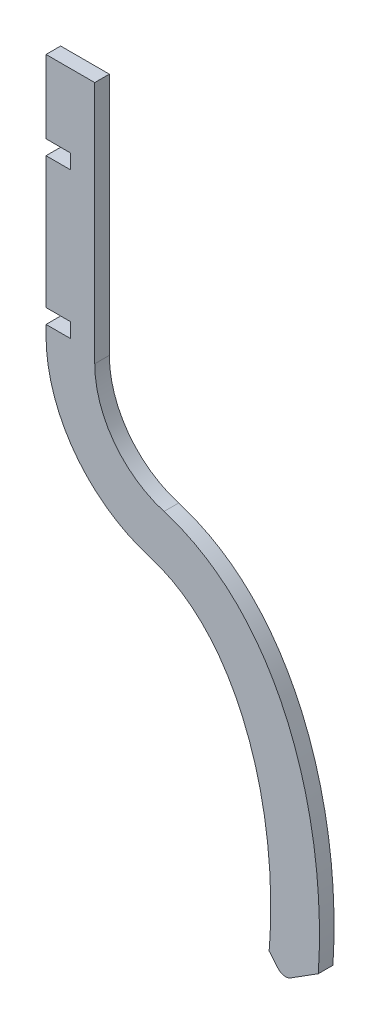
from build123d import *

# Parameters (mm, degrees)
BOSS_EXTRU_2_DEPTH      = 3
ENL_V_MAT_EXTRU_1_DEPTH = 141.768934672
EMPREINTE1_START        = 63.105178129
EMPREINTE1_DEPTH        = 3
EMPREINTE1_START_2      = 93.105178129
EMPREINTE1_2_DEPTH      = 3


# Read off the part's stored shape, not the designer's step: Empreinte1
with BuildPart() as part:
    # Esquisse1 → Boss.-Extru.2 (new body)
    with BuildSketch(Plane.XY):
        with BuildLine():
            Line((40.247233076, 111.105178129), (40.247233076, 61.105178129))
            ThreePointArc((40.247233076, 61.105178129), (44.191308202, 49.180108885), (54.467960723, 41.95837654))
            add(Edge.make_bspline(
                [(54.467960723, 41.95837654), (93.469157599, 30.186251687), (94.060386504, -42.130931626), (70.625681641, -69.023414216)],
                knots=[0.073601613, 0.073601613, 0.073601613, 0.073601613, 1, 1, 1, 1], degree=3))
            Line((70.625681641, -69.023414216), (63.086562616, -62.453658944))
            add(Edge.make_bspline(
                [(51.578324546, 32.384975746), (52.441823747, 32.124337068), (54.160244695, 31.504173294), (57.306848095, 29.97035453), (60.909260152, 27.464002891), (64.778911343, 23.487842732), (69.333722485, 16.888912111), (73.713189985, 6.383804922), (76.439302823, -8.617528818), (76.523407917, -21.892716717), (75.336804817, -32.248132674), (73.851279993, -39.698340102), (71.811754469, -46.646923176), (69.699842941, -51.863805262), (67.806756273, -55.601272185), (66.298875889, -58.166006571), (64.985680603, -60.08494816), (63.904092742, -61.488799964), (63.366023798, -62.13296342), (63.086562616, -62.453658944)],
                knots=[0.073601613, 0.073601613, 0.073601613, 0.073601613, 0.102551563, 0.131501512, 0.189401411, 0.247301311, 0.30520121, 0.421001008, 0.536800806, 0.652600605, 0.710500504, 0.768400403, 0.826300302, 0.884200202, 0.913150151, 0.942100101, 0.97105005, 0.985525025, 1, 1, 1, 1], degree=3))
            ThreePointArc((51.578324546, 32.384975746), (36.163345766, 43.217574263), (30.247233076, 61.105178129))
            Line((30.247233076, 61.105178129), (30.247233076, 111.105178129))
            Line((30.247233076, 111.105178129), (40.247233076, 111.105178129))
        make_face()
    extrude(amount=BOSS_EXTRU_2_DEPTH)

    # Esquisse2 → Enlèv. mat.-Extru.1 (cut, through all)
    with BuildSketch(Plane.XY.offset(3)):
        with BuildLine():
            Line((58.604840791, -65.718091867), (72.675095618, -21.396789164))
            Line((72.675095618, -21.396789164), (77.883188433, -27.569343611))
            ThreePointArc((77.883188433, -27.569343611), (79.106345528, -28.256142913), (80.479757382, -27.970579539))
            Line((80.479757382, -27.970579539), (87.91787168, -23.272823141))
            Line((87.91787168, -23.272823141), (76.157367596, -75.355055511))
            Line((76.157367596, -75.355055511), (58.604840791, -65.718091867))
        make_face()
    extrude(amount=-ENL_V_MAT_EXTRU_1_DEPTH, mode=Mode.SUBTRACT)

    # Empreinte1 outline → Empreinte1 (cut)
    with BuildSketch(Plane(origin=(0, 0, 0), x_dir=(1, 0, 0), z_dir=(0, 1, 0)).offset(EMPREINTE1_START)):
        with BuildLine():
            ThreePointArc((40.222725568, -0.2), (40.219098005, -0.099995306), (40.215220265, 0))
            Line((40.215220265, 0), (30.247233076, 0))
            Line((30.247233076, 0), (30.247233076, -3))
            Line((30.247233076, -3), (35.247233076, -3))
            Line((35.247233076, -3), (35.247233076, -0.2))
            Line((35.247233076, -0.2), (40.222725568, -0.2))
        make_face()
    extrude(amount=EMPREINTE1_DEPTH, mode=Mode.SUBTRACT)

    # Empreinte1 2 outline → Empreinte1 2 (cut)
    with BuildSketch(Plane(origin=(0, 0, 0), x_dir=(1, 0, 0), z_dir=(0, 1, 0)).offset(EMPREINTE1_START_2)):
        with BuildLine():
            ThreePointArc((40.222725568, -0.2), (40.219098005, -0.099995306), (40.215220265, 0))
            Line((40.215220265, 0), (30.247233076, 0))
            Line((30.247233076, 0), (30.247233076, -3))
            Line((30.247233076, -3), (35.247233076, -3))
            Line((35.247233076, -3), (35.247233076, -0.2))
            Line((35.247233076, -0.2), (40.222725568, -0.2))
        make_face()
    extrude(amount=EMPREINTE1_2_DEPTH, mode=Mode.SUBTRACT)


solid = part.part
